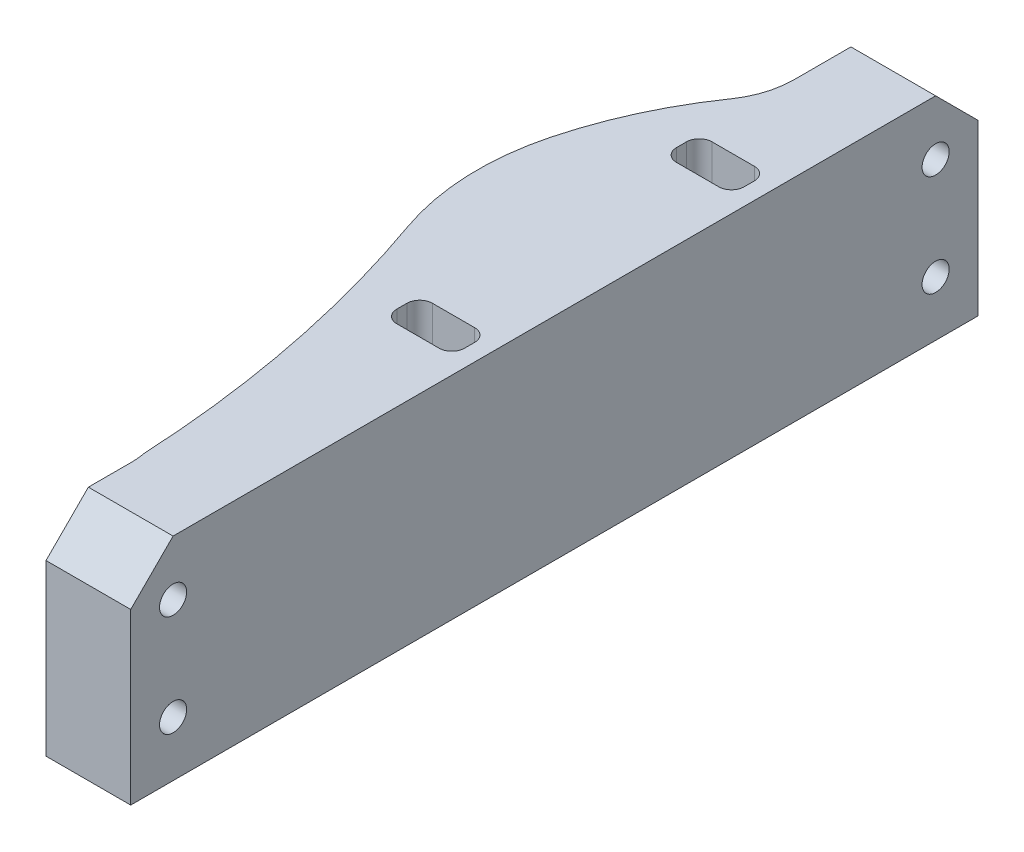
from build123d import *

# Parameters (mm, degrees)
SKETCH_1_W          = 8
SKETCH_1_H          = 4.2
EXTRUDE_1_DEPTH     = 25
SKETCH_2_R          = 1.6
CUT_EXTRUDE_1_DEPTH = 57.789083458
SKETCH_3_R          = 1.6
CUT_EXTRUDE_2_DEPTH = 57.789083458
FILLET_7_R          = 1.5
CHAMFER_1_SIZE      = 5
FILLET_8_R          = 10
SKETCH1_W           = 19
SKETCH1_H           = 8.5
CUT_EXTRUDE1_DEPTH  = 7
CHAMFER1_START      = -19
CHAMFER1_OUTLINE_W  = 27
CHAMFER1_OUTLINE_H  = 17
CHAMFER1_DEPTH      = 4.338795771
CUT_EXTRUDE3_DEPTH  = 57.789083458
FILLET7_R           = 30
FILLET8_R           = 10


with BuildPart() as part:
    # Эскиз1 → Бобышка-Вытянуть1 (new body)
    with BuildSketch(Plane(origin=(0, 0, 0), x_dir=(1, 0, 0), z_dir=(0, 1, 0))):
        Polygon((-10, -30), (0, -30), (0, -50), (10, -50), (10, 50), (0, 50), (0, 30), (-10, 30), align=None)
        with Locations((4, 25)):
            Rectangle(SKETCH_1_W, SKETCH_1_H, mode=Mode.SUBTRACT)
        with Locations((4, -8)):
            Rectangle(SKETCH_1_W, SKETCH_1_H, mode=Mode.SUBTRACT)
    extrude(amount=EXTRUDE_1_DEPTH)

    # Эскиз2 → Вырез-Вытянуть1 (cut, through all)
    with BuildSketch(Plane.ZY):
        with Locations((-45, 6.5)):
            Circle(SKETCH_2_R)
        with Locations((-45, 18.5)):
            Circle(SKETCH_2_R)
    extrude(amount=-CUT_EXTRUDE_1_DEPTH, mode=Mode.SUBTRACT)

    # Эскиз3 → Вырез-Вытянуть2 (cut, through all)
    with BuildSketch(Plane.ZY):
        with Locations((45, 6.5)):
            Circle(SKETCH_3_R)
        with Locations((45, 18.5)):
            Circle(SKETCH_3_R)
    extrude(amount=-CUT_EXTRUDE_2_DEPTH, mode=Mode.SUBTRACT)

    # Скругление7
    fillet_7_edges = [part.edges().sort_by_distance(p)[0] for p in [
        (0, 12.5, 5.9),
        (0, 12.5, 10.1),
        (8, 12.5, 10.1),
        (8, 12.5, 5.9),
        (0, 12.5, -22.9),
        (8, 12.5, -22.9),
        (8, 12.5, -27.1),
        (0, 12.5, -27.1),
    ]]
    fillet(fillet_7_edges, radius=FILLET_7_R)

    # Фаска1
    chamfer_1_edges = [part.edges().sort_by_distance(p)[0] for p in [
        (5, 25, 50),
        (5, 25, -50),
    ]]
    chamfer(chamfer_1_edges, length=CHAMFER_1_SIZE)

    # Скругление8
    fillet_8_edges = [part.edges().sort_by_distance(p)[0] for p in [
        (0, 12.5, 30),
        (0, 12.5, -30),
    ]]
    fillet(fillet_8_edges, radius=FILLET_8_R - 0.0001)  # a hair under: the kernel refuses the full size

    # Sketch1 → Cut-Extrude1 (cut)
    with BuildSketch(Plane.XZ):
        with Locations((-0.5, 8)):
            Rectangle(SKETCH1_W, SKETCH1_H)
        with Locations((-0.5, -25)):
            Rectangle(SKETCH1_W, SKETCH1_H)
    extrude(amount=-CUT_EXTRUDE1_DEPTH, mode=Mode.SUBTRACT)

    # Chamfer1: read off the stored shape, not the designer's step
    # Chamfer1 outline → Chamfer1 (cut)
    with BuildSketch(Plane(origin=(0, 0, 0), x_dir=(0, 1, 0), z_dir=(0.9555233585367056, 0, -0.29491543074368715)).offset(CHAMFER1_START)):
        with Locations((12.5, 20.5)):
            Rectangle(CHAMFER1_OUTLINE_W, CHAMFER1_OUTLINE_H)
    extrude(amount=CHAMFER1_DEPTH, mode=Mode.SUBTRACT)

    # Sketch3 → Cut-Extrude3 (cut, through all)
    with BuildSketch(Plane(origin=(0, 25, 0), x_dir=(1, 0, 0), z_dir=(0, 1, 0))):
        with BuildLine():
            Line((0, 35), (0, 45))
            Line((0, 45), (-16.541380551, 45))
            Line((-16.541380551, 45), (-16.541380551, -45))
            Line((-16.541380551, -45), (0, -45))
            ThreePointArc((0, -45), (-2.523269625, -18.845948598), (-10, 6.343330813))
            ThreePointArc((-10, 6.343330813), (-7.428201086, 21.519007807), (0, 35))
        make_face()
    extrude(amount=-CUT_EXTRUDE3_DEPTH, mode=Mode.SUBTRACT)

    # Fillet7
    fillet7_edges = [part.edges().sort_by_distance(p)[0] for p in [
        (-10, 12.5, -6.343330813),
    ]]
    fillet(fillet7_edges, radius=FILLET7_R)

    # Fillet8
    fillet8_edges = [part.edges().sort_by_distance(p)[0] for p in [
        (0, 12.5, -35),
    ]]
    fillet(fillet8_edges, radius=FILLET8_R)


solid = part.part
